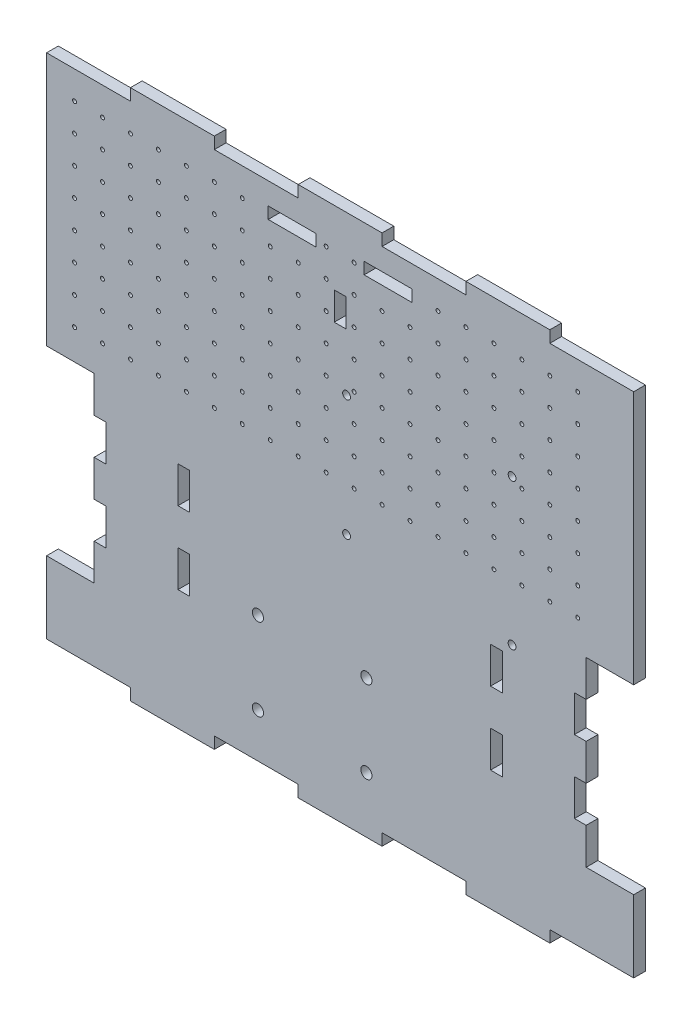
from build123d import *

# Parameters (mm, degrees)
SKETCH1_W           = 266.7
SKETCH1_H           = 241.3
BOSS_EXTRUDE1_DEPTH = 5.334
SKETCH2_W           = 21.59
SKETCH2_H           = 82.55
CUT_EXTRUDE1_DEPTH  = 180.908578328
SKETCH9_W           = 5.334
SKETCH9_H           = 16.51
CUT_EXTRUDE2_DEPTH  = 180.908578328
SKETCH10_R          = 2.54
CUT_EXTRUDE3_DEPTH  = 180.908578328
SKETCH23_W          = 5.334
SKETCH23_H          = 16.51
CUT_EXTRUDE8_DEPTH  = 180.908578328
SKETCH19_W          = 21.791696412
SKETCH19_H          = 5.334
CUT_EXTRUDE9_DEPTH  = 180.908578328
SKETCH19_5_W        = 21.791696412
SKETCH19_5_H        = 5.334
CUT_EXTRUDE11_DEPTH = 180.908578328
SKETCH27_W          = 5.334
SKETCH27_H          = 12.7
CUT_EXTRUDE12_DEPTH = 180.908578328
SKETCH28_W          = 38.1
SKETCH28_H          = 5.334
CUT_EXTRUDE13_DEPTH = 180.908578328
SKETCH29_W          = 38.1
SKETCH29_H          = 5.334
CUT_EXTRUDE14_DEPTH = 180.908578328
SKETCH30_R          = 0.889
CUT_EXTRUDE15_DEPTH = 180.908578328
SKETCH32_R          = 1.778
CUT_EXTRUDE16_DEPTH = 180.908578328


with BuildPart() as part:
    # Sketch1 → Boss-Extrude1 (new body)
    with BuildSketch(Plane.XY):
        Rectangle(SKETCH1_W, SKETCH1_H)
    extrude(amount=BOSS_EXTRUDE1_DEPTH)

    # Sketch2 → Cut-Extrude1 (cut, through all)
    with BuildSketch(Plane(origin=(0, 0, 0), x_dir=(-1, 0, 0), z_dir=(0, 0, -1))):
        with Locations((122.555, -41.275)):
            Rectangle(SKETCH2_W, SKETCH2_H)
        with Locations((-122.555, -41.275)):
            Rectangle(SKETCH2_W, SKETCH2_H)
    extrude(amount=-CUT_EXTRUDE1_DEPTH, mode=Mode.SUBTRACT)

    # Sketch9 → Cut-Extrude2 (cut, through all)
    with BuildSketch(Plane.XY.offset(5.334)):
        with Locations((-109.093, -24.765)):
            Rectangle(SKETCH9_W, SKETCH9_H)
        with Locations((-109.093, -57.785)):
            Rectangle(SKETCH9_W, SKETCH9_H)
        with Locations((109.093, -57.785)):
            Rectangle(SKETCH9_W, SKETCH9_H)
        with Locations((109.093, -24.765)):
            Rectangle(SKETCH9_W, SKETCH9_H)
    extrude(amount=-CUT_EXTRUDE2_DEPTH, mode=Mode.SUBTRACT)

    # Sketch10 → Cut-Extrude3 (cut, through all)
    with BuildSketch(Plane.XY.offset(5.334)):
        with Locations((-37.338, -95.25)):
            Circle(SKETCH10_R)
        with Locations((11.938, -95.25)):
            Circle(SKETCH10_R)
        with Locations((11.938, -57.912)):
            Circle(SKETCH10_R)
        with Locations((-37.338, -57.912)):
            Circle(SKETCH10_R)
    extrude(amount=-CUT_EXTRUDE3_DEPTH, mode=Mode.SUBTRACT)

    # Sketch23 → Cut-Extrude8 (cut, through all)
    with BuildSketch(Plane.XY.offset(5.334)):
        with Locations((-70.993, -57.785)):
            Rectangle(SKETCH23_W, SKETCH23_H)
        with Locations((70.993, -24.765)):
            Rectangle(SKETCH23_W, SKETCH23_H)
        with Locations((70.993, -57.785)):
            Rectangle(SKETCH23_W, SKETCH23_H)
        with Locations((-70.993, -24.765)):
            Rectangle(SKETCH23_W, SKETCH23_H)
    extrude(amount=-CUT_EXTRUDE8_DEPTH, mode=Mode.SUBTRACT)

    # Sketch19 → Cut-Extrude9 (cut, through all)
    with BuildSketch(Plane.XY.offset(5.334)):
        with Locations((-21.791696412, 102.743)):
            Rectangle(SKETCH19_W, SKETCH19_H)
    extrude(amount=-CUT_EXTRUDE9_DEPTH, mode=Mode.SUBTRACT)

    # Sketch19<5> → Cut-Extrude11 (cut, through all)
    with BuildSketch(Plane.XY.offset(5.334)):
        with Locations((-21.791696412, 102.743)):
            Rectangle(SKETCH19_5_W, SKETCH19_5_H)
        with Locations((21.791696412, 102.743)):
            Rectangle(SKETCH19_5_W, SKETCH19_5_H)
    extrude(amount=-CUT_EXTRUDE11_DEPTH, mode=Mode.SUBTRACT)

    # Sketch27 → Cut-Extrude12 (cut, through all)
    with BuildSketch(Plane.XY.offset(5.334)):
        with Locations((0, 81.026)):
            Rectangle(SKETCH27_W, SKETCH27_H)
    extrude(amount=-CUT_EXTRUDE12_DEPTH, mode=Mode.SUBTRACT)

    # Sketch28 → Cut-Extrude13 (cut, through all)
    with BuildSketch(Plane(origin=(0, 0, 0), x_dir=(-1, 0, 0), z_dir=(0, 0, -1))):
        with Locations((-114.3, -117.983)):
            Rectangle(SKETCH28_W, SKETCH28_H)
        with Locations((-38.1, -117.983)):
            Rectangle(SKETCH28_W, SKETCH28_H)
        with Locations((38.1, -117.983)):
            Rectangle(SKETCH28_W, SKETCH28_H)
        with Locations((114.3, -117.983)):
            Rectangle(SKETCH28_W, SKETCH28_H)
    extrude(amount=-CUT_EXTRUDE13_DEPTH, mode=Mode.SUBTRACT)

    # Sketch29 → Cut-Extrude14 (cut, through all)
    with BuildSketch(Plane(origin=(0, 0, 0), x_dir=(-1, 0, 0), z_dir=(0, 0, -1))):
        with Locations((-114.3, 117.983)):
            Rectangle(SKETCH29_W, SKETCH29_H)
        with Locations((-38.1, 117.983)):
            Rectangle(SKETCH29_W, SKETCH29_H)
        with Locations((38.1, 117.983)):
            Rectangle(SKETCH29_W, SKETCH29_H)
        with Locations((114.3, 117.983)):
            Rectangle(SKETCH29_W, SKETCH29_H)
    extrude(amount=-CUT_EXTRUDE14_DEPTH, mode=Mode.SUBTRACT)

    # Sketch30 → Cut-Extrude15 (cut, through all)
    with BuildSketch(Plane.XY.offset(5.334)):
        with Locations((-120.65, 102.616)):
            Circle(SKETCH30_R)
        with Locations((-107.95, 102.616)):
            Circle(SKETCH30_R)
        with Locations((-95.25, 102.616)):
            Circle(SKETCH30_R)
        with Locations((-82.55, 102.616)):
            Circle(SKETCH30_R)
        with Locations((-69.85, 102.616)):
            Circle(SKETCH30_R)
        with Locations((-57.15, 102.616)):
            Circle(SKETCH30_R)
        with Locations((-44.45, 102.616)):
            Circle(SKETCH30_R)
        with Locations((-6.35, 102.616)):
            Circle(SKETCH30_R)
        with Locations((6.35, 102.616)):
            Circle(SKETCH30_R)
        with Locations((44.45, 102.616)):
            Circle(SKETCH30_R)
        with Locations((57.15, 102.616)):
            Circle(SKETCH30_R)
        with Locations((69.85, 102.616)):
            Circle(SKETCH30_R)
        with Locations((82.55, 102.616)):
            Circle(SKETCH30_R)
        with Locations((95.25, 102.616)):
            Circle(SKETCH30_R)
        with Locations((107.95, 102.616)):
            Circle(SKETCH30_R)
        with Locations((-107.95, 89.916)):
            Circle(SKETCH30_R)
        with Locations((-95.25, 89.916)):
            Circle(SKETCH30_R)
        with Locations((-82.55, 89.916)):
            Circle(SKETCH30_R)
        with Locations((-69.85, 89.916)):
            Circle(SKETCH30_R)
        with Locations((-57.15, 89.916)):
            Circle(SKETCH30_R)
        with Locations((-44.45, 89.916)):
            Circle(SKETCH30_R)
        with Locations((-31.75, 89.916)):
            Circle(SKETCH30_R)
        with Locations((-19.05, 89.916)):
            Circle(SKETCH30_R)
        with Locations((-6.35, 89.916)):
            Circle(SKETCH30_R)
        with Locations((6.35, 89.916)):
            Circle(SKETCH30_R)
        with Locations((19.05, 89.916)):
            Circle(SKETCH30_R)
        with Locations((31.75, 89.916)):
            Circle(SKETCH30_R)
        with Locations((44.45, 89.916)):
            Circle(SKETCH30_R)
        with Locations((57.15, 89.916)):
            Circle(SKETCH30_R)
        with Locations((69.85, 89.916)):
            Circle(SKETCH30_R)
        with Locations((82.55, 89.916)):
            Circle(SKETCH30_R)
        with Locations((95.25, 89.916)):
            Circle(SKETCH30_R)
        with Locations((107.95, 89.916)):
            Circle(SKETCH30_R)
        with Locations((-107.95, 77.216)):
            Circle(SKETCH30_R)
        with Locations((-95.25, 77.216)):
            Circle(SKETCH30_R)
        with Locations((-82.55, 77.216)):
            Circle(SKETCH30_R)
        with Locations((-69.85, 77.216)):
            Circle(SKETCH30_R)
        with Locations((-57.15, 77.216)):
            Circle(SKETCH30_R)
        with Locations((-44.45, 77.216)):
            Circle(SKETCH30_R)
        with Locations((-31.75, 77.216)):
            Circle(SKETCH30_R)
        with Locations((-19.05, 77.216)):
            Circle(SKETCH30_R)
        with Locations((-6.35, 77.216)):
            Circle(SKETCH30_R)
        with Locations((6.35, 77.216)):
            Circle(SKETCH30_R)
        with Locations((19.05, 77.216)):
            Circle(SKETCH30_R)
        with Locations((31.75, 77.216)):
            Circle(SKETCH30_R)
        with Locations((44.45, 77.216)):
            Circle(SKETCH30_R)
        with Locations((57.15, 77.216)):
            Circle(SKETCH30_R)
        with Locations((69.85, 77.216)):
            Circle(SKETCH30_R)
        with Locations((82.55, 77.216)):
            Circle(SKETCH30_R)
        with Locations((95.25, 77.216)):
            Circle(SKETCH30_R)
        with Locations((107.95, 77.216)):
            Circle(SKETCH30_R)
        with Locations((-107.95, 64.516)):
            Circle(SKETCH30_R)
        with Locations((-95.25, 64.516)):
            Circle(SKETCH30_R)
        with Locations((-82.55, 64.516)):
            Circle(SKETCH30_R)
        with Locations((-69.85, 64.516)):
            Circle(SKETCH30_R)
        with Locations((-57.15, 64.516)):
            Circle(SKETCH30_R)
        with Locations((-44.45, 64.516)):
            Circle(SKETCH30_R)
        with Locations((-31.75, 64.516)):
            Circle(SKETCH30_R)
        with Locations((-19.05, 64.516)):
            Circle(SKETCH30_R)
        with Locations((-6.35, 64.516)):
            Circle(SKETCH30_R)
        with Locations((6.35, 64.516)):
            Circle(SKETCH30_R)
        with Locations((19.05, 64.516)):
            Circle(SKETCH30_R)
        with Locations((31.75, 64.516)):
            Circle(SKETCH30_R)
        with Locations((44.45, 64.516)):
            Circle(SKETCH30_R)
        with Locations((57.15, 64.516)):
            Circle(SKETCH30_R)
        with Locations((69.85, 64.516)):
            Circle(SKETCH30_R)
        with Locations((82.55, 64.516)):
            Circle(SKETCH30_R)
        with Locations((95.25, 64.516)):
            Circle(SKETCH30_R)
        with Locations((107.95, 64.516)):
            Circle(SKETCH30_R)
        with Locations((-107.95, 51.816)):
            Circle(SKETCH30_R)
        with Locations((-95.25, 51.816)):
            Circle(SKETCH30_R)
        with Locations((-82.55, 51.816)):
            Circle(SKETCH30_R)
        with Locations((-69.85, 51.816)):
            Circle(SKETCH30_R)
        with Locations((-57.15, 51.816)):
            Circle(SKETCH30_R)
        with Locations((-44.45, 51.816)):
            Circle(SKETCH30_R)
        with Locations((-31.75, 51.816)):
            Circle(SKETCH30_R)
        with Locations((-19.05, 51.816)):
            Circle(SKETCH30_R)
        with Locations((-6.35, 51.816)):
            Circle(SKETCH30_R)
        with Locations((6.35, 51.816)):
            Circle(SKETCH30_R)
        with Locations((19.05, 51.816)):
            Circle(SKETCH30_R)
        with Locations((31.75, 51.816)):
            Circle(SKETCH30_R)
        with Locations((44.45, 51.816)):
            Circle(SKETCH30_R)
        with Locations((57.15, 51.816)):
            Circle(SKETCH30_R)
        with Locations((69.85, 51.816)):
            Circle(SKETCH30_R)
        with Locations((82.55, 51.816)):
            Circle(SKETCH30_R)
        with Locations((95.25, 51.816)):
            Circle(SKETCH30_R)
        with Locations((107.95, 51.816)):
            Circle(SKETCH30_R)
        with Locations((-107.95, 39.116)):
            Circle(SKETCH30_R)
        with Locations((-95.25, 39.116)):
            Circle(SKETCH30_R)
        with Locations((-82.55, 39.116)):
            Circle(SKETCH30_R)
        with Locations((-69.85, 39.116)):
            Circle(SKETCH30_R)
        with Locations((-57.15, 39.116)):
            Circle(SKETCH30_R)
        with Locations((-44.45, 39.116)):
            Circle(SKETCH30_R)
        with Locations((-31.75, 39.116)):
            Circle(SKETCH30_R)
        with Locations((-19.05, 39.116)):
            Circle(SKETCH30_R)
        with Locations((-6.35, 39.116)):
            Circle(SKETCH30_R)
        with Locations((6.35, 39.116)):
            Circle(SKETCH30_R)
        with Locations((19.05, 39.116)):
            Circle(SKETCH30_R)
        with Locations((31.75, 39.116)):
            Circle(SKETCH30_R)
        with Locations((44.45, 39.116)):
            Circle(SKETCH30_R)
        with Locations((57.15, 39.116)):
            Circle(SKETCH30_R)
        with Locations((69.85, 39.116)):
            Circle(SKETCH30_R)
        with Locations((82.55, 39.116)):
            Circle(SKETCH30_R)
        with Locations((95.25, 39.116)):
            Circle(SKETCH30_R)
        with Locations((107.95, 39.116)):
            Circle(SKETCH30_R)
        with Locations((-107.95, 26.416)):
            Circle(SKETCH30_R)
        with Locations((-95.25, 26.416)):
            Circle(SKETCH30_R)
        with Locations((-82.55, 26.416)):
            Circle(SKETCH30_R)
        with Locations((-69.85, 26.416)):
            Circle(SKETCH30_R)
        with Locations((-57.15, 26.416)):
            Circle(SKETCH30_R)
        with Locations((-44.45, 26.416)):
            Circle(SKETCH30_R)
        with Locations((-31.75, 26.416)):
            Circle(SKETCH30_R)
        with Locations((-19.05, 26.416)):
            Circle(SKETCH30_R)
        with Locations((-6.35, 26.416)):
            Circle(SKETCH30_R)
        with Locations((6.35, 26.416)):
            Circle(SKETCH30_R)
        with Locations((19.05, 26.416)):
            Circle(SKETCH30_R)
        with Locations((31.75, 26.416)):
            Circle(SKETCH30_R)
        with Locations((44.45, 26.416)):
            Circle(SKETCH30_R)
        with Locations((57.15, 26.416)):
            Circle(SKETCH30_R)
        with Locations((69.85, 26.416)):
            Circle(SKETCH30_R)
        with Locations((82.55, 26.416)):
            Circle(SKETCH30_R)
        with Locations((95.25, 26.416)):
            Circle(SKETCH30_R)
        with Locations((107.95, 26.416)):
            Circle(SKETCH30_R)
        with Locations((-107.95, 13.716)):
            Circle(SKETCH30_R)
        with Locations((-95.25, 13.716)):
            Circle(SKETCH30_R)
        with Locations((-82.55, 13.716)):
            Circle(SKETCH30_R)
        with Locations((-69.85, 13.716)):
            Circle(SKETCH30_R)
        with Locations((-57.15, 13.716)):
            Circle(SKETCH30_R)
        with Locations((-44.45, 13.716)):
            Circle(SKETCH30_R)
        with Locations((-31.75, 13.716)):
            Circle(SKETCH30_R)
        with Locations((-19.05, 13.716)):
            Circle(SKETCH30_R)
        with Locations((-6.35, 13.716)):
            Circle(SKETCH30_R)
        with Locations((6.35, 13.716)):
            Circle(SKETCH30_R)
        with Locations((19.05, 13.716)):
            Circle(SKETCH30_R)
        with Locations((31.75, 13.716)):
            Circle(SKETCH30_R)
        with Locations((44.45, 13.716)):
            Circle(SKETCH30_R)
        with Locations((57.15, 13.716)):
            Circle(SKETCH30_R)
        with Locations((69.85, 13.716)):
            Circle(SKETCH30_R)
        with Locations((82.55, 13.716)):
            Circle(SKETCH30_R)
        with Locations((95.25, 13.716)):
            Circle(SKETCH30_R)
        with Locations((107.95, 13.716)):
            Circle(SKETCH30_R)
        with Locations((-120.65, 89.916)):
            Circle(SKETCH30_R)
        with Locations((-120.65, 77.216)):
            Circle(SKETCH30_R)
        with Locations((-120.65, 64.516)):
            Circle(SKETCH30_R)
        with Locations((-120.65, 51.816)):
            Circle(SKETCH30_R)
        with Locations((-120.65, 39.116)):
            Circle(SKETCH30_R)
        with Locations((-120.65, 26.416)):
            Circle(SKETCH30_R)
        with Locations((-120.65, 13.716)):
            Circle(SKETCH30_R)
    extrude(amount=-CUT_EXTRUDE15_DEPTH, mode=Mode.SUBTRACT)

    # Sketch32 → Cut-Extrude16 (cut, through all)
    with BuildSketch(Plane(origin=(0, 0, 0), x_dir=(-1, 0, 0), z_dir=(0, 0, -1))):
        with Locations((-78.105, -11.938)):
            Circle(SKETCH32_R)
        with Locations((-2.921, -6.096)):
            Circle(SKETCH32_R)
        with Locations((-78.105, 54.356)):
            Circle(SKETCH32_R)
        with Locations((-2.921, 48.768)):
            Circle(SKETCH32_R)
    extrude(amount=-CUT_EXTRUDE16_DEPTH, mode=Mode.SUBTRACT)


solid = part.part
